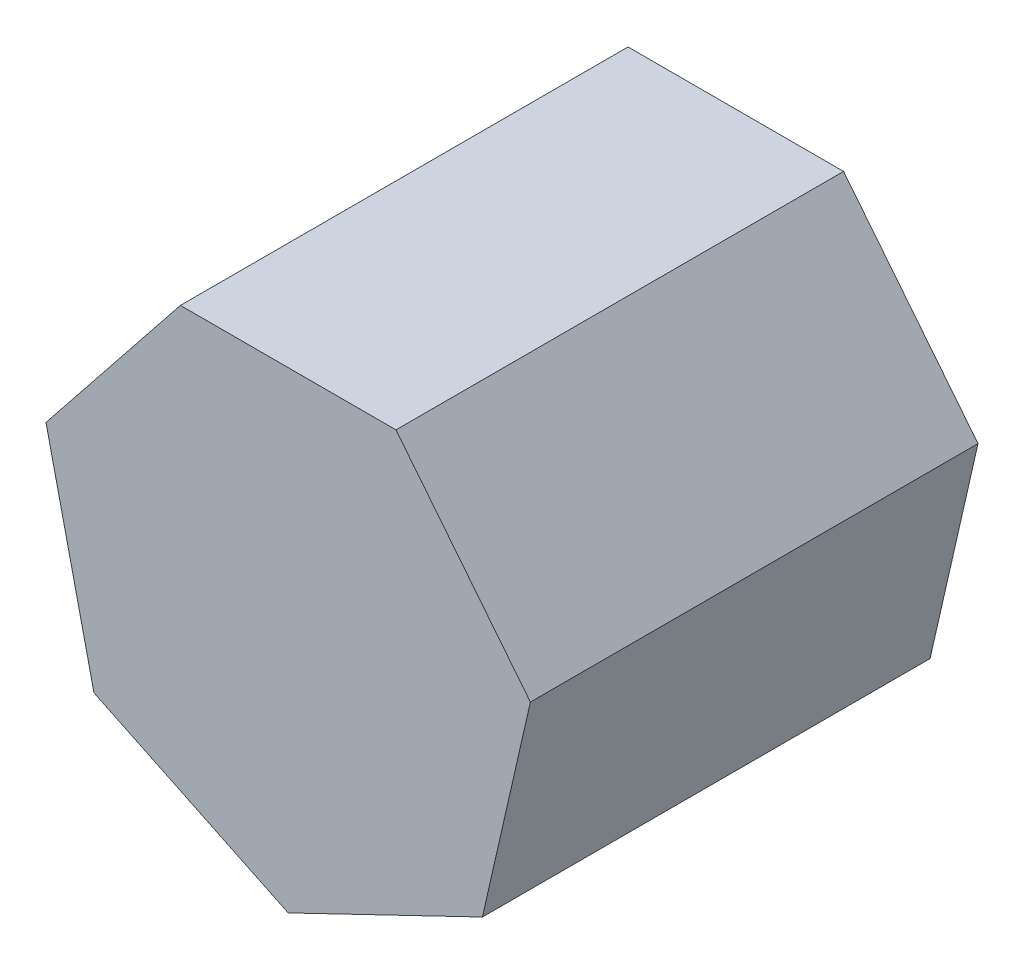
from build123d import *

# Parameters (mm, degrees)
BOSS_EXTRUDE1_DEPTH = 200
CUT_EXTRUDE1_DEPTH  = 1
SKETCH4_W           = 1.794871794
SKETCH4_H           = 20.512820513
SKETCH4_W_2         = 1.794871795
SKETCH4_H_2         = 14.615384616
CUT_EXTRUDE3_DEPTH  = 1


with BuildPart() as part:
    # Sketch1 → Boss-Extrude1 (new body)
    with BuildSketch(Plane.XY):
        Polygon((0, -110.991626417), (86.776747824, -69.202147163), (108.208834613, 24.697960372), (48.157461881, 100), (-48.157461881, 100), (-108.208834613, 24.697960372), (-86.776747824, -69.202147163), align=None)
    extrude(amount=BOSS_EXTRUDE1_DEPTH)

    # Sketch2 → Cut-Extrude1 (cut)
    # profile 1 of 6: a face of its own
    with BuildSketch(Plane(origin=(-78.183148247, 62.348980186, 0), x_dir=(0, 0, 1), z_dir=(-0.7818314824680302, 0.6234898018587328, 0))):
        with BuildLine():
            Line((145.128205128, -35.364993932), (143.91025641, -36.619000342))
            add(Edge.make_bspline(
                [(143.91025641, -36.619000342), (143.805167819, -36.497210935), (143.602569386, -36.262415294), (143.281246637, -35.9484892), (142.961111759, -35.684849549), (142.64654711, -35.462265212), (142.329642716, -35.293984375), (142.014117469, -35.171156592), (141.699644678, -35.095146274), (141.489438762, -35.085349481), (141.386217949, -35.080538804)],
                knots=[0, 0, 0, 0, 1.26578478, 2.440284043, 3.530471711, 4.527705817, 5.468200915, 6.346673037, 7.188140097, 8, 8, 8, 8], degree=3))
            add(Edge.make_bspline(
                [(141.386217949, -35.080538804), (141.25970715, -35.086680935), (141.010751801, -35.09876778), (140.65403284, -35.219415954), (140.322886411, -35.404608745), (140.036275097, -35.667286365), (139.793488354, -35.968796473), (139.616267319, -36.305918329), (139.50789027, -36.668478579), (139.494148944, -36.920077766), (139.487179487, -37.04768624)],
                knots=[0, 0, 0, 0, 0.99966794, 1.967205029, 2.953328237, 3.988086729, 5.028030931, 6.008226631, 6.989793394, 8, 8, 8, 8], degree=3))
            add(Edge.make_bspline(
                [(139.487179487, -37.04768624), (139.493526986, -37.163183635), (139.50620409, -37.39385284), (139.604756542, -37.734127319), (139.761705526, -38.065881823), (139.908392351, -38.26909843), (139.983974359, -38.373808035)],
                knots=[0, 0, 0, 0, 0.960159726, 1.917612774, 2.927026955, 4, 4, 4, 4], degree=3))
            add(Edge.make_bspline(
                [(139.983974359, -38.373808035), (140.029480038, -38.429719945), (140.126333139, -38.5487214), (140.308096082, -38.713886276), (140.513938956, -38.896413425), (140.761481457, -39.078909636), (141.040058759, -39.271090923), (141.355711812, -39.465388826), (141.698423269, -39.676614111), (141.943779307, -39.810582314), (142.071314103, -39.880218291)],
                knots=[0, 0, 0, 0, 0.66740084, 1.420478572, 2.27185888, 3.217733974, 4.268547843, 5.408967954, 6.65319498, 8, 8, 8, 8], degree=3))
            add(Edge.make_bspline(
                [(142.071314103, -39.880218291), (142.226820257, -39.967332021), (142.527206943, -40.135607064), (142.954022756, -40.396805369), (143.341377276, -40.656413508), (143.69255252, -40.911655073), (144.000791428, -41.169671459), (144.275446014, -41.420572928), (144.509665694, -41.671940404), (144.640830989, -41.847558196), (144.703525641, -41.931500342)],
                knots=[0, 0, 0, 0, 1.27191281, 2.456916733, 3.569705269, 4.599008579, 5.553216877, 6.436649441, 7.252746552, 8, 8, 8, 8], degree=3))
            add(Edge.make_bspline(
                [(144.703525641, -41.931500342), (144.807585798, -42.101020845), (145.014684822, -42.438398109), (145.232160631, -42.99393198), (145.358219344, -43.583134851), (145.375717745, -43.986176109), (145.384615385, -44.191115727)],
                knots=[0, 0, 0, 0, 0.995354457, 1.980940102, 2.973342416, 4, 4, 4, 4], degree=3))
            add(Edge.make_bspline(
                [(145.384615385, -44.191115727), (145.380503763, -44.335510848), (145.372401363, -44.620057209), (145.316069552, -45.039113379), (145.219183973, -45.439882279), (145.087219665, -45.826712477), (144.909023248, -46.192192132), (144.700178693, -46.545542126), (144.449464911, -46.879118874), (144.163228479, -47.19248436), (143.849825657, -47.478688631), (143.515504866, -47.730254082), (143.159854405, -47.939250295), (142.78541554, -48.112195125), (142.391337517, -48.249728027), (141.977558721, -48.344942491), (141.545394409, -48.401929698), (141.251509791, -48.40984099), (141.101762821, -48.413872137)],
                knots=[0, 0, 0, 0, 1.032770009, 2.035186124, 3.017557409, 3.978232242, 4.952395191, 5.920591857, 6.910227898, 7.931268572, 8.952309245, 9.941945286, 10.918353717, 11.897095711, 12.887975737, 13.898235213, 14.929059601, 16, 16, 16, 16], degree=3))
            add(Edge.make_bspline(
                [(141.101762821, -48.413872137), (140.899664675, -48.408199564), (140.498276521, -48.396933237), (139.904620983, -48.291184316), (139.324502362, -48.126639208), (138.762310703, -47.899691013), (138.230618624, -47.613115511), (137.744156198, -47.269901833), (137.301233555, -46.881387562), (137.049129134, -46.583599501), (136.923076923, -46.43470547)],
                knots=[0, 0, 0, 0, 1.013940152, 2.01379169, 3.017749504, 4.037548394, 5.051665909, 6.043208538, 7.021604269, 8, 8, 8, 8], degree=3))
            Line((136.923076923, -46.43470547), (138.112980769, -45.080538804))
            add(Edge.make_bspline(
                [(138.112980769, -45.080538804), (138.225965986, -45.20256603), (138.445004913, -45.439134258), (138.795297581, -45.75413049), (139.151751301, -46.018137754), (139.510806653, -46.238957267), (139.877778621, -46.409102428), (140.250610702, -46.52863725), (140.628544554, -46.605461206), (140.88238533, -46.614479962), (141.009615385, -46.619000342)],
                knots=[0, 0, 0, 0, 1.179806542, 2.287233372, 3.337373186, 4.324005949, 5.273901747, 6.200048787, 7.097828587, 8, 8, 8, 8], degree=3))
            add(Edge.make_bspline(
                [(141.009615385, -46.619000342), (141.182860676, -46.611167057), (141.521352913, -46.595862133), (142.006174391, -46.456907321), (142.453823685, -46.239021882), (142.842528517, -45.929966464), (143.173398009, -45.570220335), (143.412987577, -45.164996796), (143.563137151, -44.726188472), (143.580771429, -44.422003886), (143.58974359, -44.267237522)],
                knots=[0, 0, 0, 0, 1.072336372, 2.095165389, 3.102688358, 4.141489647, 5.156069229, 6.117746104, 7.042326257, 8, 8, 8, 8], degree=3))
            add(Edge.make_bspline(
                [(143.58974359, -44.267237522), (143.583536194, -44.139753987), (143.571280521, -43.888054811), (143.475033252, -43.523767148), (143.322959811, -43.178228402), (143.173218963, -42.976001846), (143.096955128, -42.873006753)],
                knots=[0, 0, 0, 0, 1.013901739, 2.00181326, 2.98231254, 4, 4, 4, 4], degree=3))
            add(Edge.make_bspline(
                [(143.096955128, -42.873006753), (143.051112874, -42.821376112), (142.951251889, -42.708905929), (142.768079082, -42.546476907), (142.548754155, -42.371402054), (142.290810367, -42.186650118), (141.993727727, -41.994658087), (141.656302153, -41.796433217), (141.283156139, -41.582560499), (141.01932396, -41.440733897), (140.881410256, -41.366596496)],
                knots=[0, 0, 0, 0, 0.615000592, 1.339693406, 2.178160186, 3.116406724, 4.166410947, 5.330106347, 6.604359322, 8, 8, 8, 8], degree=3))
            add(Edge.make_bspline(
                [(140.881410256, -41.366596496), (140.732572313, -41.283515744), (140.443928042, -41.122395651), (140.035086379, -40.871446621), (139.666244355, -40.616205051), (139.328526786, -40.370988827), (139.030463897, -40.122869147), (138.773229907, -39.871570567), (138.546697245, -39.62722779), (138.421283463, -39.45410038), (138.361378205, -39.371404188)],
                knots=[0, 0, 0, 0, 1.262093308, 2.447601706, 3.550203992, 4.582594899, 5.537233252, 6.418365656, 7.244515135, 8, 8, 8, 8], degree=3))
            add(Edge.make_bspline(
                [(138.361378205, -39.371404188), (138.257774779, -39.204857817), (138.05053172, -38.871706872), (137.849302056, -38.315647005), (137.710981891, -37.730246678), (137.698625376, -37.326321796), (137.692307692, -37.119801624)],
                knots=[0, 0, 0, 0, 0.985009483, 1.970363186, 2.962279964, 4, 4, 4, 4], degree=3))
            add(Edge.make_bspline(
                [(137.692307692, -37.119801624), (137.695360237, -36.98479935), (137.701334499, -36.720580773), (137.749014794, -36.332358943), (137.835824572, -35.96351235), (137.944709844, -35.608501704), (138.096041298, -35.274204024), (138.276875042, -34.956161332), (138.489374613, -34.654813229), (138.734193418, -34.374795331), (139.003374248, -34.120456324), (139.294201504, -33.898749878), (139.600134398, -33.709570708), (139.922468224, -33.550912648), (140.264299498, -33.430904747), (140.623238849, -33.348291118), (140.998559734, -33.293118531), (141.255137597, -33.28818662), (141.386217949, -33.285667009)],
                knots=[0, 0, 0, 0, 1.087655834, 2.128696564, 3.144119009, 4.137814668, 5.115653402, 6.093965665, 7.082169637, 8.081268856, 9.086088321, 10.061021666, 11.022561449, 11.980240094, 12.950172527, 13.934149372, 14.944599409, 16, 16, 16, 16], degree=3))
            add(Edge.make_bspline(
                [(141.386217949, -33.285667009), (141.541601169, -33.291977527), (141.855282436, -33.304716943), (142.325880299, -33.405892317), (142.795785111, -33.572367198), (143.266204254, -33.802288531), (143.733691622, -34.099813536), (144.202359374, -34.459409533), (144.677833833, -34.878710759), (144.974727051, -35.199277761), (145.128205128, -35.364993932)],
                knots=[0, 0, 0, 0, 0.845714091, 1.707292901, 2.609013841, 3.555613372, 4.552488639, 5.621697636, 6.770543573, 8, 8, 8, 8], degree=3))
        make_face()
    # profile 2 of 6: a face of its own
    with BuildSketch(Plane(origin=(-78.183148247, 62.348980186, 0), x_dir=(0, 0, 1), z_dir=(-0.7818314824680302, 0.6234898018587328, 0))):
        with BuildLine():
            Line((132.251602564, -43.542077265), (133.846153846, -44.379417009))
            add(Edge.make_bspline(
                [(133.846153846, -44.379417009), (133.719087588, -44.604807473), (133.471866968, -45.043328061), (133.046719837, -45.645795835), (132.601050851, -46.187782783), (132.114742462, -46.654809379), (131.602344297, -47.06196015), (131.061014841, -47.418176291), (130.487935882, -47.721710693), (129.883080312, -47.977439424), (129.241368591, -48.174065104), (128.56124564, -48.312946367), (127.841408524, -48.398793616), (127.348001782, -48.408765849), (127.095352564, -48.413872137)],
                knots=[0, 0, 0, 0, 1.120438281, 2.179929193, 3.190490725, 4.156257408, 5.095198341, 6.022838206, 6.959905092, 7.901321166, 8.864066838, 9.862729781, 10.905609505, 12, 12, 12, 12], degree=3))
            add(Edge.make_bspline(
                [(127.095352564, -48.413872137), (126.814541264, -48.40731685), (126.266759769, -48.394529383), (125.469389785, -48.284286729), (124.718650252, -48.104444679), (124.014583375, -47.853213013), (123.35891336, -47.525056876), (122.750337047, -47.125288408), (122.185654042, -46.655961239), (121.682658561, -46.113010133), (121.229836374, -45.531970377), (120.83026026, -44.92650818), (120.496217797, -44.298146897), (120.224488596, -43.65088676), (120.005032225, -42.988807368), (119.852079632, -42.305884696), (119.763909643, -41.603967072), (119.750398526, -41.129125154), (119.743589744, -40.889833676)],
                knots=[0, 0, 0, 0, 1.145258523, 2.234067595, 3.276747158, 4.290159414, 5.277019952, 6.260822364, 7.254936242, 8.264827045, 9.274100331, 10.257902744, 11.220704747, 12.172965371, 13.118907548, 14.062713208, 15.023725156, 16, 16, 16, 16], degree=3))
            add(Edge.make_bspline(
                [(119.743589744, -40.889833676), (119.74964198, -40.665291788), (119.761636713, -40.220279418), (119.837241212, -39.561619163), (119.971231458, -38.921456578), (120.155096166, -38.299259732), (120.392531859, -37.696070395), (120.683001683, -37.11152146), (121.026958127, -36.546234946), (121.292516263, -36.189645611), (121.426282051, -36.010025983)],
                knots=[0, 0, 0, 0, 1.024358464, 2.0301432, 3.019427413, 4.004406732, 4.986367066, 5.972626655, 6.978780325, 8, 8, 8, 8], degree=3))
            add(Edge.make_bspline(
                [(121.426282051, -36.010025983), (121.60746881, -35.79363244), (121.964102791, -35.367700152), (122.567281964, -34.808052576), (123.220425943, -34.339231003), (123.915349521, -33.950618797), (124.660129373, -33.655340814), (125.444753893, -33.435297487), (126.278157243, -33.311994567), (126.847901362, -33.294578375), (127.139423077, -33.285667009)],
                knots=[0, 0, 0, 0, 1.030682036, 2.02871468, 2.997146059, 3.962720338, 4.930598197, 5.918074684, 6.934738563, 8, 8, 8, 8], degree=3))
            add(Edge.make_bspline(
                [(127.139423077, -33.285667009), (127.439123679, -33.293404431), (128.027067941, -33.30858349), (128.884394347, -33.449305395), (129.695598442, -33.67246285), (130.460355609, -33.987627367), (131.178743385, -34.394253377), (131.84609224, -34.897921043), (132.473815168, -35.483167255), (132.839007048, -35.933242738), (133.024839744, -36.162269573)],
                knots=[0, 0, 0, 0, 1.056321875, 2.072262726, 3.055038591, 4.01806755, 4.982017516, 5.957941055, 6.960871419, 8, 8, 8, 8], degree=3))
            add(Edge.make_bspline(
                [(133.024839744, -36.162269573), (133.151279391, -36.334861467), (133.403317066, -36.678896431), (133.71901478, -37.239874471), (133.993057037, -37.826792153), (134.212102529, -38.449136708), (134.389471107, -39.099534309), (134.517795786, -39.782634564), (134.593050749, -40.498234058), (134.607843305, -40.985814375), (134.615384615, -41.234384958)],
                knots=[0, 0, 0, 0, 0.94817472, 1.890038105, 2.849395472, 3.817997239, 4.812318967, 5.836947057, 6.897266129, 8, 8, 8, 8], degree=3))
            Line((134.615384615, -41.234384958), (121.538461538, -41.234384958))
            add(Edge.make_bspline(
                [(121.538461538, -41.234384958), (121.547259289, -41.426959039), (121.564559712, -41.805648203), (121.645217673, -42.359766964), (121.772353523, -42.887614633), (121.951033881, -43.385232016), (122.167415854, -43.859118459), (122.432477093, -44.30575867), (122.748703115, -44.723118271), (123.101421398, -45.114930485), (123.494033371, -45.463849121), (123.907077641, -45.776144985), (124.346469441, -46.037891252), (124.808744203, -46.250347765), (125.293154404, -46.416669571), (125.799852662, -46.530199975), (126.327841898, -46.606240585), (126.687760379, -46.614695815), (126.87099359, -46.619000342)],
                knots=[0, 0, 0, 0, 1.094153842, 2.151609401, 3.174256925, 4.172055639, 5.149267565, 6.128595816, 7.11444997, 8.118368179, 9.117203808, 10.09244225, 11.054858984, 12.015122123, 12.976791628, 13.957293641, 14.960065497, 16, 16, 16, 16], degree=3))
            add(Edge.make_bspline(
                [(126.87099359, -46.619000342), (127.050143005, -46.615525733), (127.40560981, -46.608631441), (127.934986138, -46.54159195), (128.455783437, -46.433190375), (128.965846199, -46.285247575), (129.454822461, -46.10480842), (129.907654176, -45.887077805), (130.324112551, -45.646222109), (130.71335236, -45.370738252), (131.090900893, -45.033548612), (131.465429387, -44.612773063), (131.867010263, -44.115130047), (132.118379365, -43.740583384), (132.251602564, -43.542077265)],
                knots=[0, 0, 0, 0, 0.99110716, 1.966546729, 2.947904876, 3.932708344, 4.903319531, 5.828989031, 6.710028674, 7.56322171, 8.463672341, 9.504779593, 10.677557249, 12, 12, 12, 12], degree=3))
        make_face()
        with BuildLine():
            add(Edge.make_bspline(
                [(132.820512821, -39.439513163), (132.754817823, -39.201439599), (132.6283761, -38.743224624), (132.364168303, -38.10870525), (132.066616642, -37.544774387), (131.714492463, -37.055747912), (131.315528317, -36.621442124), (130.854698701, -36.241907352), (130.337922167, -35.90237906), (129.767869935, -35.615793349), (129.164202592, -35.371851299), (128.532167209, -35.208279209), (127.887265564, -35.096224681), (127.451069642, -35.085789776), (127.231570513, -35.080538804)],
                knots=[0, 0, 0, 0, 1.154881502, 2.222775134, 3.210006277, 4.132804581, 5.035138423, 5.962687519, 6.919655026, 7.923214229, 8.944639381, 9.960483929, 10.97369054, 12, 12, 12, 12], degree=3))
            add(Edge.make_bspline(
                [(127.231570513, -35.080538804), (127.052430864, -35.08403407), (126.698309441, -35.090943476), (126.176589051, -35.156487072), (125.6755622, -35.264829043), (125.191531985, -35.413200223), (124.730841309, -35.610963666), (124.284014062, -35.842867818), (123.862411798, -36.125962583), (123.598747252, -36.341727468), (123.465544872, -36.450731112)],
                knots=[0, 0, 0, 0, 1.04873581, 2.073130211, 3.073294108, 4.04793562, 5.032784715, 6.005352987, 6.992311501, 8, 8, 8, 8], degree=3))
            add(Edge.make_bspline(
                [(123.465544872, -36.450731112), (123.370154689, -36.536984344), (123.177108208, -36.711539864), (122.919162371, -37.012278187), (122.672188241, -37.336572828), (122.447424511, -37.696830683), (122.241266874, -38.08894942), (122.048352719, -38.509621621), (121.874716078, -38.962039509), (121.777024021, -39.27731059), (121.726762821, -39.439513163)],
                knots=[0, 0, 0, 0, 0.879870761, 1.780643979, 2.707998968, 3.669668524, 4.684282772, 5.740141944, 6.837334558, 8, 8, 8, 8], degree=3))
            Line((121.726762821, -39.439513163), (132.820512821, -39.439513163))
        make_face(mode=Mode.SUBTRACT)
    # profile 3 of 6: a face of its own
    with BuildSketch(Plane(origin=(-78.183148247, 62.348980186, 0), x_dir=(0, 0, 1), z_dir=(-0.7818314824680302, 0.6234898018587328, 0))):
        with BuildLine():
            Line((111.538461538, -33.542077265), (113.333333333, -33.542077265))
            Line((113.333333333, -33.542077265), (113.333333333, -35.693519573))
            add(Edge.make_bspline(
                [(113.333333333, -35.693519573), (113.465840526, -35.493200554), (113.719259503, -35.110091987), (114.140476242, -34.603410267), (114.571923849, -34.183895715), (115.015667777, -33.849589893), (115.474971205, -33.599229214), (115.939753786, -33.415840442), (116.4173279, -33.307398641), (116.738253181, -33.29292059), (116.899038462, -33.285667009)],
                knots=[0, 0, 0, 0, 1.2804753, 2.448899062, 3.506932113, 4.484331642, 5.4025378, 6.288909075, 7.142734305, 8, 8, 8, 8], degree=3))
            add(Edge.make_bspline(
                [(116.899038462, -33.285667009), (117.023760327, -33.292470018), (117.280383671, -33.306467651), (117.668855613, -33.404815221), (118.06910391, -33.561832493), (118.327060408, -33.709490908), (118.461538462, -33.786468291)],
                knots=[0, 0, 0, 0, 0.901110191, 1.854092781, 2.881294221, 4, 4, 4, 4], degree=3))
            Line((118.461538462, -33.786468291), (117.475961538, -35.34095547))
            add(Edge.make_bspline(
                [(117.475961538, -35.34095547), (117.389624275, -35.302439664), (117.22573962, -35.22932929), (116.985999242, -35.142803518), (116.764963032, -35.091855428), (116.624142698, -35.084137042), (116.55849359, -35.080538804)],
                knots=[0, 0, 0, 0, 1.180555205, 2.24091978, 3.179933427, 4, 4, 4, 4], degree=3))
            add(Edge.make_bspline(
                [(116.55849359, -35.080538804), (116.414460827, -35.090139017), (116.120675741, -35.10972067), (115.689335745, -35.263656715), (115.270780285, -35.512372372), (114.938370786, -35.788207297), (114.680986483, -36.054194711), (114.497328052, -36.286471297), (114.328855212, -36.54692062), (114.167882524, -36.831090242), (114.021217986, -37.143832219), (113.884334162, -37.48202201), (113.760569231, -37.846051318), (113.689996407, -38.099665719), (113.653846154, -38.229577265)],
                knots=[0, 0, 0, 0, 1.125678352, 2.296057538, 3.5422874, 4.923748041, 5.663163013, 6.437101912, 7.23742474, 8.08941207, 8.991984279, 9.93940061, 10.944477711, 12, 12, 12, 12], degree=3))
            add(Edge.make_bspline(
                [(113.653846154, -38.229577265), (113.626803906, -38.345446829), (113.566907382, -38.602089107), (113.508670023, -39.032652105), (113.45112992, -39.541358727), (113.410577815, -40.129624972), (113.372989003, -40.795981794), (113.351788533, -41.54144434), (113.334056302, -42.366777776), (113.333581634, -42.94377408), (113.333333333, -43.245602906)],
                knots=[0, 0, 0, 0, 0.566838948, 1.255505196, 2.06880316, 3.007127437, 4.065329342, 5.249902469, 6.561414163, 8, 8, 8, 8], degree=3))
            Line((113.333333333, -43.245602906), (113.333333333, -48.157461881))
            Line((113.333333333, -48.157461881), (111.538461538, -48.157461881))
            Line((111.538461538, -48.157461881), (111.538461538, -33.542077265))
        make_face()
    # profile 4 of 6: a face of its own
    with BuildSketch(Plane(origin=(-78.183148247, 62.348980186, 0), x_dir=(0, 0, 1), z_dir=(-0.7818314824680302, 0.6234898018587328, 0))):
        with BuildLine():
            Line((107.948717949, -27.644641368), (107.948717949, -48.157461881))
            Line((107.948717949, -48.157461881), (106.153846154, -48.157461881))
            Line((106.153846154, -48.157461881), (106.153846154, -45.629417009))
            add(Edge.make_bspline(
                [(106.153846154, -45.629417009), (105.951453065, -45.858214689), (105.556480406, -46.304716238), (104.896816875, -46.888042938), (104.197570144, -47.370204775), (103.462134023, -47.759632865), (102.691172632, -48.052158901), (101.886394991, -48.26007981), (101.047472814, -48.393758868), (100.474602216, -48.407107565), (100.184294872, -48.413872137)],
                knots=[0, 0, 0, 0, 1.074387032, 2.096679803, 3.090159297, 4.057316773, 5.018401886, 5.985159533, 6.978961417, 8, 8, 8, 8], degree=3))
            add(Edge.make_bspline(
                [(100.184294872, -48.413872137), (99.926192278, -48.406864296), (99.417202536, -48.393044522), (98.668464953, -48.285831358), (97.947937813, -48.113656377), (97.254940255, -47.874222723), (96.593956567, -47.556618028), (95.959327443, -47.176382325), (95.354340631, -46.723577582), (94.788217551, -46.205931705), (94.266891835, -45.643674636), (93.809398849, -45.043985797), (93.427952678, -44.409458346), (93.108980788, -43.748126038), (92.863287391, -43.054897926), (92.692009481, -42.332171252), (92.584921215, -41.580800546), (92.571107153, -41.069146129), (92.564102564, -40.80970547)],
                knots=[0, 0, 0, 0, 1.033919861, 2.038935746, 3.024066025, 3.998881131, 4.97069526, 5.957263378, 6.95902576, 7.993208707, 9.027059324, 10.027763471, 11.009749337, 11.988697705, 12.965288445, 13.950418724, 14.960734635, 16, 16, 16, 16], degree=3))
            add(Edge.make_bspline(
                [(92.564102564, -40.80970547), (92.571262401, -40.555627164), (92.585417011, -40.05332806), (92.690863982, -39.314592643), (92.868184031, -38.603059724), (93.117028875, -37.921020049), (93.43612576, -37.267648333), (93.824286258, -36.642482476), (94.281538399, -36.043800205), (94.80869501, -35.485678909), (95.37975084, -34.970132542), (95.990657874, -34.522080853), (96.626219481, -34.135127432), (97.296293827, -33.828536138), (97.990962997, -33.580484112), (98.716411259, -33.408867152), (99.46962028, -33.307739602), (99.98099452, -33.293095235), (100.240384615, -33.285667009)],
                knots=[0, 0, 0, 0, 1.020392517, 2.01726096, 2.990465484, 3.961182959, 4.928053699, 5.906110375, 6.912531644, 7.948652711, 8.985773172, 9.998621852, 10.987621588, 11.969261332, 12.953316658, 13.946091881, 14.958173133, 16, 16, 16, 16], degree=3))
            add(Edge.make_bspline(
                [(100.240384615, -33.285667009), (100.538766374, -33.294621843), (101.124456606, -33.312199188), (101.981019586, -33.459092714), (102.791234504, -33.70573773), (103.559765861, -34.043402195), (104.282031919, -34.482263631), (104.963327008, -35.012271904), (105.591803139, -35.648427025), (105.963642125, -36.126207444), (106.153846154, -36.370602906)],
                knots=[0, 0, 0, 0, 1.031072012, 2.023879775, 2.993683497, 3.952812103, 4.918022106, 5.908088563, 6.929940113, 8, 8, 8, 8], degree=3))
            Line((106.153846154, -36.370602906), (106.153846154, -27.644641368))
            Line((106.153846154, -27.644641368), (107.948717949, -27.644641368))
        make_face()
        with BuildLine():
            add(Edge.make_bspline(
                [(100.264423077, -35.080538804), (100.002055432, -35.089873877), (99.484183432, -35.108299825), (98.723931992, -35.252148369), (97.996426768, -35.491488909), (97.305306344, -35.818814058), (96.661487963, -36.230406839), (96.086095559, -36.728243315), (95.574422979, -37.298740538), (95.144090041, -37.939324026), (94.793287201, -38.626055975), (94.546618447, -39.343909907), (94.383937034, -40.07993835), (94.367316916, -40.579153698), (94.358974359, -40.829737522)],
                knots=[0, 0, 0, 0, 1.031046209, 2.035121221, 3.029706178, 4.034933723, 5.034054252, 6.02443088, 7.017295772, 8.038157696, 9.050218397, 10.03989886, 11.016116709, 12, 12, 12, 12], degree=3))
            add(Edge.make_bspline(
                [(94.358974359, -40.829737522), (94.369630892, -41.078823849), (94.390902189, -41.576020168), (94.543763299, -42.313052035), (94.800219719, -43.031075133), (95.150174363, -43.723995095), (95.588383647, -44.367332812), (96.096318805, -44.948704941), (96.678891841, -45.448645445), (97.324191881, -45.867145866), (98.013380284, -46.205217414), (98.738145606, -46.44044964), (99.484863539, -46.592322672), (99.992591161, -46.610062539), (100.248397436, -46.619000342)],
                knots=[0, 0, 0, 0, 0.979072187, 1.954306742, 2.945804271, 3.96968567, 4.997920485, 5.998718438, 6.996577872, 8.005894225, 9.015743152, 10.005417472, 10.995077863, 12, 12, 12, 12], degree=3))
            add(Edge.make_bspline(
                [(100.248397436, -46.619000342), (100.508091737, -46.609514834), (101.024597946, -46.590649099), (101.787104848, -46.446184726), (102.527076064, -46.207505878), (103.234431655, -45.876653726), (103.893380976, -45.466611692), (104.484797419, -44.986571172), (104.984888667, -44.428267263), (105.408846436, -43.814687531), (105.741277389, -43.142047551), (105.983426298, -42.425852175), (106.126591474, -41.666076472), (106.144635644, -41.146854032), (106.153846154, -40.881820855)],
                knots=[0, 0, 0, 0, 1.01762866, 2.023962475, 3.030623092, 4.058876274, 5.077231937, 6.066672613, 7.034107872, 8.005628644, 8.981990164, 9.965428785, 10.961468474, 12, 12, 12, 12], degree=3))
            add(Edge.make_bspline(
                [(106.153846154, -40.881820855), (106.148362403, -40.679890395), (106.137568646, -40.282427347), (106.055108249, -39.698841533), (105.923937241, -39.140363098), (105.739101984, -38.606404875), (105.496294644, -38.099919073), (105.203450268, -37.617269014), (104.855419126, -37.160964949), (104.45780372, -36.737290258), (104.022573991, -36.350853331), (103.562033759, -36.005914812), (103.070726634, -35.722550397), (102.556914994, -35.488028845), (102.019707369, -35.301405132), (101.454732398, -35.176904024), (100.86799533, -35.091416476), (100.467732156, -35.084202871), (100.264423077, -35.080538804)],
                knots=[0, 0, 0, 0, 1.050140795, 2.067009409, 3.05949893, 4.030605086, 5.00011959, 5.97591094, 6.962425594, 7.979863591, 8.993523472, 9.986985069, 10.967611495, 11.937549037, 12.921786183, 13.919465291, 14.943216303, 16, 16, 16, 16], degree=3))
        make_face(mode=Mode.SUBTRACT)
    # profile 5 of 6: a face of its own
    with BuildSketch(Plane(origin=(-78.183148247, 62.348980186, 0), x_dir=(0, 0, 1), z_dir=(-0.7818314824680302, 0.6234898018587328, 0))):
        with BuildLine():
            Line((76.153846154, -33.542077265), (77.948717949, -33.542077265))
            Line((77.948717949, -33.542077265), (77.948717949, -36.178295214))
            add(Edge.make_bspline(
                [(77.948717949, -36.178295214), (78.140361578, -35.939193941), (78.512252727, -35.475209578), (79.131591774, -34.865377723), (79.786128347, -34.36283358), (80.471854082, -33.962240472), (81.189699854, -33.660259751), (81.935289968, -33.442168716), (82.713088288, -33.311398268), (83.242027928, -33.294311237), (83.509615385, -33.285667009)],
                knots=[0, 0, 0, 0, 1.12780773, 2.188550248, 3.19190651, 4.159438251, 5.104880172, 6.052711206, 7.014878035, 8, 8, 8, 8], degree=3))
            add(Edge.make_bspline(
                [(83.509615385, -33.285667009), (83.780076151, -33.295639554), (84.30943311, -33.315158231), (85.080164889, -33.469539323), (85.800012853, -33.733226495), (86.466410315, -34.094438326), (87.067137248, -34.543618174), (87.594707828, -35.066919784), (88.031069241, -35.66884026), (88.323625601, -36.227258296), (88.516343588, -36.722622834), (88.637671231, -37.146889978), (88.740705411, -37.619565127), (88.830029685, -38.139219922), (88.890470325, -38.709495295), (88.938140562, -39.328053535), (88.972304529, -39.994694281), (88.973659998, -40.455760723), (88.974358974, -40.693519573)],
                knots=[0, 0, 0, 0, 1.235846778, 2.418850247, 3.575807741, 4.728682307, 5.871620074, 6.994088408, 8.11269785, 9.256955736, 9.865816715, 10.540099792, 11.271859618, 12.076849838, 12.949306005, 13.892391288, 14.913166135, 16, 16, 16, 16], degree=3))
            Line((88.974358974, -40.693519573), (88.974358974, -48.157461881))
            Line((88.974358974, -48.157461881), (87.179487179, -48.157461881))
            Line((87.179487179, -48.157461881), (87.179487179, -41.282461881))
            add(Edge.make_bspline(
                [(87.179487179, -41.282461881), (87.178383134, -41.083476481), (87.176271282, -40.702851277), (87.169610444, -40.15788543), (87.153554406, -39.66367641), (87.130992618, -39.22140574), (87.097969586, -38.831498102), (87.06355455, -38.493159378), (87.021468968, -38.206819135), (86.983966608, -38.034447236), (86.967147436, -37.957141368)],
                knots=[0, 0, 0, 0, 1.430800155, 2.736877192, 3.918605307, 4.986035426, 5.920637409, 6.731861385, 7.431261377, 8, 8, 8, 8], degree=3))
            add(Edge.make_bspline(
                [(86.967147436, -37.957141368), (86.906430113, -37.730220311), (86.789568052, -37.293467485), (86.500802434, -36.701042613), (86.136149973, -36.197052968), (85.691019405, -35.784614559), (85.169710401, -35.463638349), (84.573669585, -35.240930036), (83.908648781, -35.101637069), (83.440909452, -35.087767743), (83.197115385, -35.080538804)],
                knots=[0, 0, 0, 0, 1.084156227, 2.086665306, 3.027808233, 3.945421172, 4.874247719, 5.839848303, 6.874090471, 8, 8, 8, 8], degree=3))
            add(Edge.make_bspline(
                [(83.197115385, -35.080538804), (83.052728621, -35.08325883), (82.766990947, -35.088641693), (82.343276822, -35.14264911), (81.932281546, -35.230983142), (81.529880352, -35.350232499), (81.144121531, -35.514016895), (80.762611295, -35.69989901), (80.3997155, -35.931603079), (80.047696088, -36.189835201), (79.72019433, -36.4760021), (79.415460968, -36.777970729), (79.143815138, -37.099545608), (78.897708422, -37.435545308), (78.685261203, -37.790584382), (78.499814985, -38.161237562), (78.342468158, -38.547992698), (78.264281344, -38.81642162), (78.225160256, -38.950731112)],
                knots=[0, 0, 0, 0, 1.023777757, 2.026029729, 3.023749952, 4.003683103, 4.997618607, 5.993177895, 7.010360494, 8.046726602, 9.087585522, 10.09234134, 11.086953743, 12.070360549, 13.043493632, 14.017870808, 15.008233677, 16, 16, 16, 16], degree=3))
            add(Edge.make_bspline(
                [(78.225160256, -38.950731112), (78.202647979, -39.049332272), (78.153639928, -39.26398184), (78.100707472, -39.616235665), (78.052664184, -40.023721236), (78.012452992, -40.485963048), (77.987850612, -41.004579477), (77.961025487, -41.577355693), (77.951259424, -42.206575627), (77.94958883, -42.644642442), (77.948717949, -42.873006753)],
                knots=[0, 0, 0, 0, 0.615963638, 1.340920617, 2.168419149, 3.115676021, 4.16674242, 5.331190069, 6.6087489, 8, 8, 8, 8], degree=3))
            Line((77.948717949, -42.873006753), (77.948717949, -48.157461881))
            Line((77.948717949, -48.157461881), (76.153846154, -48.157461881))
            Line((76.153846154, -48.157461881), (76.153846154, -33.542077265))
        make_face()
    # profile 6 of 6: a face of its own
    with BuildSketch(Plane(origin=(-78.183148247, 62.348980186, 0), x_dir=(0, 0, 1), z_dir=(-0.7818314824680302, 0.6234898018587328, 0))):
        Polygon((63.846153846, -28.157461881), (73.076923077, -48.157461881), (71.125801282, -48.157461881), (68.169070513, -41.74720547), (59.102564103, -41.74720547), (56.065705128, -48.157461881), (54.102564103, -48.157461881), (63.58974359, -28.157461881), align=None)
        Polygon((63.697916667, -32.05970547), (60.080128205, -39.695923419), (67.223557692, -39.695923419), align=None, mode=Mode.SUBTRACT)
    extrude(amount=-CUT_EXTRUDE1_DEPTH, mode=Mode.SUBTRACT)

    # Sketch4 → Cut-Extrude3 (cut)
    # profile 1 of 6: a face of its own
    with BuildSketch(Plane(origin=(-97.492791218, -22.252093396, 0), x_dir=(0, 0, 1), z_dir=(-0.9749279121818235, -0.22252093395631528, 0))):
        Polygon((109.743589744, -33.542077265), (111.674679487, -33.542077265), (116.630608974, -44.735987522), (121.650641026, -33.542077265), (123.58974359, -33.542077265), (114.615384615, -53.542077265), (112.676282051, -53.542077265), (115.661057692, -46.90345547), align=None)
    # profile 2 of 6: a face of its own
    with BuildSketch(Plane(origin=(-97.492791218, -22.252093396, 0), x_dir=(0, 0, 1), z_dir=(-0.9749279121818235, -0.22252093395631528, 0))):
        with Locations((106.282051282, -37.901051624)):
            Rectangle(SKETCH4_W, SKETCH4_H)
    # profile 3 of 6: a face of its own
    with BuildSketch(Plane(origin=(-97.492791218, -22.252093396, 0), x_dir=(0, 0, 1), z_dir=(-0.9749279121818235, -0.22252093395631528, 0))):
        with Locations((100.641025641, -37.901051624)):
            Rectangle(SKETCH4_W, SKETCH4_H)
    # profile 4 of 6: a face of its own
    with BuildSketch(Plane(origin=(-97.492791218, -22.252093396, 0), x_dir=(0, 0, 1), z_dir=(-0.9749279121818235, -0.22252093395631528, 0))):
        with BuildLine():
            add(Edge.make_bspline(
                [(94.735576923, -27.388231112), (94.84695587, -27.393397697), (95.065057241, -27.403514863), (95.380447342, -27.490151874), (95.667630268, -27.63700722), (95.92236017, -27.834033968), (96.14094238, -28.065745073), (96.293975011, -28.335807749), (96.39233156, -28.6275714), (96.404209019, -28.831086195), (96.41025641, -28.93470547)],
                knots=[0, 0, 0, 0, 1.055194115, 2.066272739, 3.074728998, 4.095836921, 5.109056067, 6.073838105, 7.019297344, 8, 8, 8, 8], degree=3))
            add(Edge.make_bspline(
                [(96.41025641, -28.93470547), (96.40407264, -29.035634917), (96.391848058, -29.235160489), (96.294050982, -29.521866043), (96.139638194, -29.788176235), (95.922500333, -30.019437436), (95.667593128, -30.216355264), (95.380457209, -30.363239487), (95.065054646, -30.449868843), (94.846954993, -30.459987064), (94.735576923, -30.465154188)],
                knots=[0, 0, 0, 0, 0.96129708, 1.900370562, 2.859976407, 3.87933698, 4.906634145, 5.921202961, 6.938410037, 8, 8, 8, 8], degree=3))
            add(Edge.make_bspline(
                [(94.735576923, -30.465154188), (94.625472494, -30.460184359), (94.411168607, -30.450511234), (94.100500936, -30.361539704), (93.815766711, -30.216305001), (93.56054001, -30.0207268), (93.34779605, -29.786755959), (93.192948476, -29.522028565), (93.095377265, -29.235119111), (93.083122244, -29.035621017), (93.076923077, -28.93470547)],
                knots=[0, 0, 0, 0, 1.054934014, 2.053291228, 3.073705704, 4.106921865, 5.123545215, 6.088680038, 7.033164197, 8, 8, 8, 8], degree=3))
            add(Edge.make_bspline(
                [(93.076923077, -28.93470547), (93.082986429, -28.831100616), (93.094895235, -28.627614144), (93.193021613, -28.335642527), (93.346506229, -28.067176802), (93.560680878, -27.832745377), (93.815729222, -27.637057178), (94.100510623, -27.49185157), (94.411166048, -27.402872488), (94.625471625, -27.393200406), (94.735576923, -27.388231112)],
                knots=[0, 0, 0, 0, 0.98631895, 1.937192651, 2.907499808, 3.917963147, 4.944918757, 5.95915025, 6.951458133, 8, 8, 8, 8], degree=3))
        make_face()
    # profile 5 of 6: a face of its own
    with BuildSketch(Plane(origin=(-97.492791218, -22.252093396, 0), x_dir=(0, 0, 1), z_dir=(-0.9749279121818235, -0.22252093395631528, 0))):
        with Locations((94.743589744, -40.849769573)):
            Rectangle(SKETCH4_W_2, SKETCH4_H_2)
    # profile 6 of 6: a face of its own
    with BuildSketch(Plane(origin=(-97.492791218, -22.252093396, 0), x_dir=(0, 0, 1), z_dir=(-0.9749279121818235, -0.22252093395631528, 0))):
        with BuildLine():
            Line((78.717948718, -28.157461881), (82.620192308, -28.157461881))
            add(Edge.make_bspline(
                [(82.620192308, -28.157461881), (82.811212183, -28.158466169), (83.181456242, -28.160412729), (83.719853053, -28.19060205), (84.224131971, -28.231765878), (84.694439241, -28.297080693), (85.13055754, -28.375890848), (85.533801182, -28.471329797), (85.90288788, -28.585767589), (86.343532089, -28.767746339), (86.845935865, -29.038164444), (87.38992668, -29.437756245), (87.855093762, -29.926513177), (88.256158432, -30.477842637), (88.575021973, -31.084332761), (88.805703672, -31.731528125), (88.951748674, -32.411080936), (88.966768298, -32.877613381), (88.974358974, -33.113391368)],
                knots=[0, 0, 0, 0, 1.001505555, 1.941167018, 2.826882275, 3.653841531, 4.429895133, 5.150066043, 5.825578002, 6.45369114, 7.647487171, 8.808567382, 9.977351308, 11.170798116, 12.373658725, 13.556498008, 14.765093433, 16, 16, 16, 16], degree=3))
            add(Edge.make_bspline(
                [(88.974358974, -33.113391368), (88.968112012, -33.334263115), (88.955836141, -33.768296926), (88.838448945, -34.403120408), (88.654673697, -35.007413087), (88.39921513, -35.578969575), (88.067203723, -36.104875936), (87.673727617, -36.589374599), (87.199003031, -37.011952067), (86.843327374, -37.248197225), (86.662660256, -37.36819906)],
                knots=[0, 0, 0, 0, 1.044552857, 2.05264487, 3.044412934, 4.028983338, 5.005914585, 5.980388656, 6.974128949, 8, 8, 8, 8], degree=3))
            add(Edge.make_bspline(
                [(86.662660256, -37.36819906), (86.8898627, -37.455427626), (87.324557256, -37.622317479), (87.922763042, -37.917377274), (88.438162156, -38.238303619), (88.874717276, -38.588771334), (89.248075304, -38.966535967), (89.574092113, -39.37713662), (89.852271394, -39.825929522), (90.090630957, -40.308235438), (90.276623849, -40.819129543), (90.415914731, -41.353819692), (90.495728726, -41.910388579), (90.507086676, -42.289162175), (90.512820513, -42.480378547)],
                knots=[0, 0, 0, 0, 1.27268992, 2.434971085, 3.483601985, 4.442670788, 5.356604649, 6.2567628, 7.179492994, 8.113709626, 9.066344395, 10.018646069, 10.999752585, 12, 12, 12, 12], degree=3))
            add(Edge.make_bspline(
                [(90.512820513, -42.480378547), (90.507238536, -42.675617817), (90.496255839, -43.059756549), (90.415227429, -43.624071603), (90.278032532, -44.163357013), (90.089054552, -44.681100914), (89.842412755, -45.176301682), (89.542252958, -45.649520333), (89.184358309, -46.096002223), (88.783999058, -46.52070864), (88.331072512, -46.902581711), (87.842411056, -47.242671463), (87.311860656, -47.522363247), (86.748134976, -47.757311941), (86.144910313, -47.936781647), (85.504895413, -48.062339212), (84.82864226, -48.146939423), (84.364586539, -48.15389488), (84.126602564, -48.157461881)],
                knots=[0, 0, 0, 0, 0.978564426, 1.925352924, 2.850884081, 3.763762016, 4.682927383, 5.618979971, 6.567305752, 7.547517671, 8.540179244, 9.531824382, 10.526200242, 11.540722885, 12.589160233, 13.674978461, 14.80764778, 16, 16, 16, 16], degree=3))
            Line((84.126602564, -48.157461881), (78.717948718, -48.157461881))
            Line((78.717948718, -48.157461881), (78.717948718, -28.157461881))
        make_face()
        with BuildLine():
            Line((80.512820513, -30.208743932), (80.512820513, -36.619000342))
            Line((80.512820513, -36.619000342), (81.71875, -36.619000342))
            add(Edge.make_bspline(
                [(81.71875, -36.619000342), (81.895028831, -36.616715068), (82.235635455, -36.612299452), (82.728892007, -36.599650783), (83.186749254, -36.564233392), (83.608416871, -36.528826181), (83.993230837, -36.471257108), (84.340338617, -36.402730692), (84.655187742, -36.330256948), (85.018270859, -36.207002737), (85.430116279, -36.024844593), (85.869162589, -35.742148387), (86.256216701, -35.405437797), (86.583057773, -35.016918016), (86.850551891, -34.58911124), (87.036344549, -34.128843351), (87.16232903, -33.647585454), (87.173709209, -33.317195438), (87.179487179, -33.14944906)],
                knots=[0, 0, 0, 0, 1.156816544, 2.235205308, 3.236616184, 4.169592532, 5.011045266, 5.787822928, 6.49130361, 7.128639758, 8.301311294, 9.436451833, 10.541879658, 11.654887649, 12.756523258, 13.837046038, 14.901820046, 16, 16, 16, 16], degree=3))
            add(Edge.make_bspline(
                [(87.179487179, -33.14944906), (87.176480436, -33.038444652), (87.170582379, -32.820697382), (87.122277793, -32.503272502), (87.040177367, -32.204736773), (86.934724263, -31.920999), (86.787360328, -31.660931284), (86.613854823, -31.415541594), (86.404222307, -31.193186632), (86.165609092, -30.985360927), (85.891274104, -30.801106482), (85.581381008, -30.639730693), (85.231737139, -30.509783397), (84.848235111, -30.395976812), (84.424971754, -30.316043704), (83.966831448, -30.249452918), (83.470061625, -30.215551535), (83.126375325, -30.211063747), (82.948717949, -30.208743932)],
                knots=[0, 0, 0, 0, 0.91205012, 1.789085906, 2.630437955, 3.453916878, 4.269457761, 5.079663411, 5.91843418, 6.774407191, 7.675494373, 8.627863946, 9.638891023, 10.736472738, 11.911756761, 13.175263542, 14.539845004, 16, 16, 16, 16], degree=3))
            Line((82.948717949, -30.208743932), (80.512820513, -30.208743932))
        make_face(mode=Mode.SUBTRACT)
        with BuildLine():
            Line((80.512820513, -38.670282394), (80.512820513, -46.106179829))
            Line((80.512820513, -46.106179829), (83.068910256, -46.106179829))
            add(Edge.make_bspline(
                [(83.068910256, -46.106179829), (83.251875547, -46.103986987), (83.604517025, -46.099760573), (84.113666911, -46.085963118), (84.585570362, -46.054578686), (85.018073994, -46.00517383), (85.415848009, -45.951582692), (85.774120598, -45.87951823), (86.095795989, -45.796952741), (86.468792034, -45.6693289), (86.888812081, -45.471063352), (87.341445546, -45.172124915), (87.743881078, -44.815991728), (88.085625417, -44.403815075), (88.365699637, -43.955636064), (88.569445094, -43.480519779), (88.695107133, -42.986316765), (88.710319529, -42.649364122), (88.717948718, -42.480378547)],
                knots=[0, 0, 0, 0, 1.160039823, 2.235823828, 3.228722157, 4.157150951, 4.99529583, 5.772374946, 6.472645482, 7.099169577, 8.269452708, 9.405989375, 10.527446681, 11.663510218, 12.788923519, 13.866172445, 14.929861265, 16, 16, 16, 16], degree=3))
            add(Edge.make_bspline(
                [(88.717948718, -42.480378547), (88.716370979, -42.374702316), (88.71324095, -42.16505442), (88.666037436, -41.856964025), (88.597386751, -41.558530463), (88.508635701, -41.268943374), (88.379381603, -40.993438367), (88.22848706, -40.726566598), (88.051564765, -40.467975287), (87.775883817, -40.141048124), (87.374901048, -39.764379479), (86.805148046, -39.395593752), (86.157306343, -39.098177711), (85.687434955, -38.97189499), (85.444711538, -38.906660599)],
                knots=[0, 0, 0, 0, 0.723448775, 1.435228256, 2.130040452, 2.821711965, 3.505591119, 4.210454504, 4.921174351, 5.648778258, 7.137944449, 8.670945889, 10.280296675, 12, 12, 12, 12], degree=3))
            add(Edge.make_bspline(
                [(85.444711538, -38.906660599), (85.347402419, -38.886917262), (85.136416177, -38.844109635), (84.792372861, -38.798922759), (84.399596467, -38.758665273), (83.957180026, -38.72888723), (83.464563791, -38.698106981), (82.920695684, -38.686136574), (82.327796743, -38.671855088), (81.916411758, -38.670820035), (81.702724359, -38.670282394)],
                knots=[0, 0, 0, 0, 0.634451884, 1.375622551, 2.216452059, 3.157844607, 4.20941857, 5.370758133, 6.634282058, 8, 8, 8, 8], degree=3))
            Line((81.702724359, -38.670282394), (80.512820513, -38.670282394))
        make_face(mode=Mode.SUBTRACT)
    extrude(amount=-CUT_EXTRUDE3_DEPTH, mode=Mode.SUBTRACT)


solid = part.part
